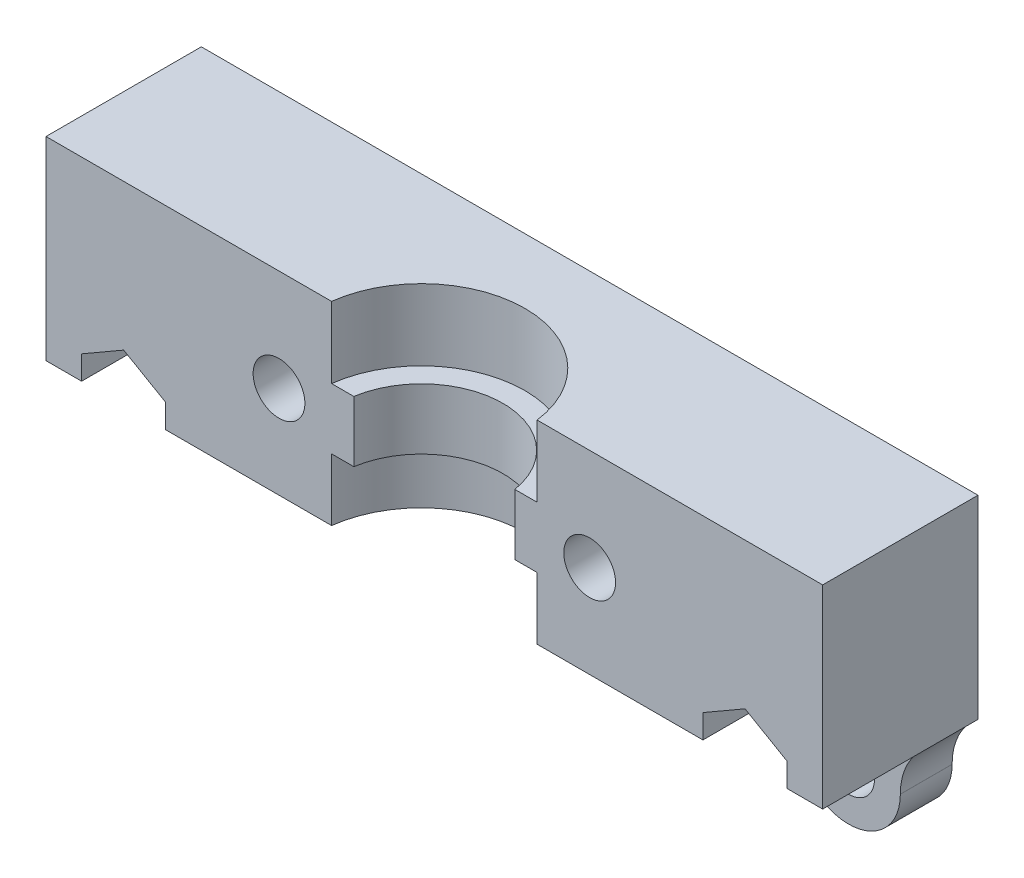
from build123d import *

# Parameters (mm, degrees)
SCHIZZO1_W                   = 60
SCHIZZO1_H                   = 30
ESTRUSIONE_ESTRUSIONE1_DEPTH = 5
SCHIZZO2_W                   = 60
SCHIZZO2_H                   = 8
ESTRUSIONE_ESTRUSIONE2_DEPTH = 20
SCHIZZO3_R                   = 5
TAGLIO_ESTRUSIONE1_DEPTH     = 8
RACCORDO1_R                  = 20
SCHIZZO4_W                   = 60
SCHIZZO4_H                   = 15
ESTRUSIONE_ESTRUSIONE3_DEPTH = 10
SCHIZZO6_R                   = 8
TAGLIO_ESTRUSIONE2_DEPTH     = 15
SCHIZZO8_W                   = 60
SCHIZZO8_H                   = 4.7
ESTRUSIONE_ESTRUSIONE4_DEPTH = 10
SCHIZZO9_R                   = 6.3
TAGLIO_ESTRUSIONE3_DEPTH     = 5
SCHIZZO10_R                  = 2
TAGLIO_ESTRUSIONE4_DEPTH     = 37.742346142
SCHIZZO11_W                  = 60
SCHIZZO11_H                  = 8
TAGLIO_ESTRUSIONE5_DEPTH     = 25
SCHIZZO14_W                  = 60
SCHIZZO14_H                  = 5
TAGLIO_ESTRUSIONE7_DEPTH     = 7
SCHIZZO12_R                  = 2
ESTRUSIONE_ESTRUSIONE5_DEPTH = 4
SCHIZZO17_W                  = 60
SCHIZZO17_H                  = 15
TAGLIO_ESTRUSIONE9_DEPTH     = 3
TAGLIO_ESTRUSIONE10_REACH    = 38.058
TAGLIO_ESTRUSIONE12_DEPTH    = 8
RACCORDO2_R                  = 5
RACCORDO3_R                  = 10


with BuildPart() as part:
    # Schizzo1 → Estrusione-Estrusione1 (new body)
    with BuildSketch(Plane.XY):
        Rectangle(SCHIZZO1_W, SCHIZZO1_H)
    extrude(amount=ESTRUSIONE_ESTRUSIONE1_DEPTH)

    # Schizzo2 → Estrusione-Estrusione2 (add)
    with BuildSketch(Plane.XY.offset(5)):
        with Locations((0, 11)):
            Rectangle(SCHIZZO2_W, SCHIZZO2_H)
    extrude(amount=ESTRUSIONE_ESTRUSIONE2_DEPTH)

    # Schizzo3 → Taglio-Estrusione1 (cut)
    with BuildSketch(Plane(origin=(0, 15, 0), x_dir=(1, 0, 0), z_dir=(0, 1, 0))):
        with Locations(Location((11, -13, 0), (0, 0, 270))):
            Circle(SCHIZZO3_R)
        with Locations(Location((-11, -13, 0), (0, 0, 270))):
            Circle(SCHIZZO3_R)
    extrude(amount=-TAGLIO_ESTRUSIONE1_DEPTH, mode=Mode.SUBTRACT)

    # Raccordo1
    raccordo1_edges = [part.edges().sort_by_distance(p)[0] for p in [
        (30, 11, 25),
        (-30, 11, 25),
    ]]
    fillet(raccordo1_edges, radius=RACCORDO1_R)

    # Schizzo4 → Estrusione-Estrusione3 (add)
    with BuildSketch(Plane.XY.offset(5)):
        with Locations((0, -0.5)):
            Rectangle(SCHIZZO4_W, SCHIZZO4_H)
    extrude(amount=ESTRUSIONE_ESTRUSIONE3_DEPTH)

    # Schizzo6 → Taglio-Estrusione2 (cut)
    with BuildSketch(Plane.XZ.offset(8)):
        with Locations((0, 13)):
            Circle(SCHIZZO6_R)
    extrude(amount=-TAGLIO_ESTRUSIONE2_DEPTH, mode=Mode.SUBTRACT)

    # Schizzo8 → Estrusione-Estrusione4 (add)
    with BuildSketch(Plane.XY.offset(15)):
        with Locations((0, -0.85)):
            Rectangle(SCHIZZO8_W, SCHIZZO8_H)
    extrude(amount=-ESTRUSIONE_ESTRUSIONE4_DEPTH)

    # Schizzo9 → Taglio-Estrusione3 (cut)
    with BuildSketch(Plane.XZ.offset(3.2)):
        with Locations((0, 13)):
            Circle(SCHIZZO9_R)
    extrude(amount=-TAGLIO_ESTRUSIONE3_DEPTH, mode=Mode.SUBTRACT)

    # Schizzo10 → Taglio-Estrusione4 (cut, through all)
    with BuildSketch(Plane.XY.offset(15)):
        with Locations((12, -0.85)):
            Circle(SCHIZZO10_R)
        with Locations((-12, -0.85)):
            Circle(SCHIZZO10_R)
    extrude(amount=-TAGLIO_ESTRUSIONE4_DEPTH, mode=Mode.SUBTRACT)

    # Schizzo11 → Taglio-Estrusione5 (cut)
    with BuildSketch(Plane(origin=(0, 0, 0), x_dir=(-1, 0, 0), z_dir=(0, 0, -1))):
        with Locations((0, 11)):
            Rectangle(SCHIZZO11_W, SCHIZZO11_H)
    extrude(amount=-TAGLIO_ESTRUSIONE5_DEPTH, mode=Mode.SUBTRACT)

    # Schizzo14 → Taglio-Estrusione7 (cut)
    with BuildSketch(Plane.XZ.offset(15)):
        with Locations((0, 2.5)):
            Rectangle(SCHIZZO14_W, SCHIZZO14_H)
    extrude(amount=-TAGLIO_ESTRUSIONE7_DEPTH, mode=Mode.SUBTRACT)

    # Schizzo12 → Estrusione-Estrusione5 (add)
    with BuildSketch(Plane.XY):
        with BuildLine():
            Line((-8, -8.006435696), (8, -8.006435696))
            Line((8, -8.006435696), (20, -8.006435696))
            Line((20, -8.006435696), (20, -12.006435696))
            ThreePointArc((20, -12.006435696), (24, -16.006435696), (28, -12.006435696))
            Line((28, -12.006435696), (28, -5.256435696))
            Line((28, -5.256435696), (-28, -5.256435696))
            Line((-28, -5.256435696), (-28, -12.006435696))
            ThreePointArc((-28, -12.006435696), (-24, -16.006435696), (-20, -12.006435696))
            Line((-20, -12.006435696), (-20, -8.006435696))
            Line((-20, -8.006435696), (-8, -8.006435696))
        make_face()
        with Locations((24, -12.006435696)):
            Circle(SCHIZZO12_R, mode=Mode.SUBTRACT)
        with Locations(Location((-24, -12.006435696, 0), (0, 0, 180))):
            Circle(SCHIZZO12_R, mode=Mode.SUBTRACT)
    extrude(amount=ESTRUSIONE_ESTRUSIONE5_DEPTH)

    # Schizzo17 → Taglio-Estrusione9 (cut)
    with BuildSketch(Plane.XY.offset(15)):
        with Locations((0, -0.5)):
            Rectangle(SCHIZZO17_W, SCHIZZO17_H)
    extrude(amount=-TAGLIO_ESTRUSIONE9_DEPTH, mode=Mode.SUBTRACT)

    # Taglio-Estrusione10: up to this face of the body (flat: up to its plane)
    taglio_estrusione10_end = Plane(part.part.faces().sort_by_distance((-18.942934314, -0.495179718, 12))[0])
    # Schizzo18 → Taglio-Estrusione10 (cut, up to the picked face)
    with BuildSketch(Plane(origin=(0, 0, 0), x_dir=(-1, 0, 0), z_dir=(0, 0, -1)), mode=Mode.PRIVATE) as taglio_estrusione10_sk1:
        with BuildLine():
            Line((-26, -8.043105695), (-26, -12.006435696))
            Line((-26, -12.006435696), (-22, -12.006435696))
            Line((-22, -12.006435696), (-22, -8.043105695))
            ThreePointArc((-22, -8.043105695), (-24, -6.043105695), (-26, -8.043105695))
        make_face()
    taglio_estrusione10_tool1 = split(extrude(taglio_estrusione10_sk1.sketch, amount=-TAGLIO_ESTRUSIONE10_REACH, mode=Mode.PRIVATE), bisect_by=taglio_estrusione10_end, keep=Keep.BOTH, mode=Mode.PRIVATE)
    # Schizzo18 → Taglio-Estrusione10 (cut, up to the picked face)
    with BuildSketch(Plane(origin=(0, 0, 0), x_dir=(-1, 0, 0), z_dir=(0, 0, -1)), mode=Mode.PRIVATE) as taglio_estrusione10_sk2:
        with BuildLine():
            Line((22, -12.006435696), (22, -8.043105695))
            ThreePointArc((22, -8.043105695), (24, -6.043105695), (26, -8.043105695))
            Line((26, -8.043105695), (26, -12.006435696))
            Line((26, -12.006435696), (22, -12.006435696))
        make_face()
    taglio_estrusione10_tool2 = split(extrude(taglio_estrusione10_sk2.sketch, amount=-TAGLIO_ESTRUSIONE10_REACH, mode=Mode.PRIVATE), bisect_by=taglio_estrusione10_end, keep=Keep.BOTH, mode=Mode.PRIVATE)
    add(taglio_estrusione10_tool1.solids().sort_by(Axis((24, -9.221369, 0), (0, 0, 1)))[0], mode=Mode.SUBTRACT)
    add(taglio_estrusione10_tool2.solids().sort_by(Axis((-24, -9.221369, 0), (0, 0, 1)))[0], mode=Mode.SUBTRACT)

    # Schizzo20 → Taglio-Estrusione12 (cut)
    with BuildSketch(Plane.XY.offset(4)):
        Polygon((-27.25, -9.91949407), (-24, -11.795882445), (-20.75, -9.91949407), (-20.75, -6.166717321), (-24, -4.290328946), (-27.25, -6.166717321), align=None)
    taglio_estrusione12 = extrude(amount=TAGLIO_ESTRUSIONE12_DEPTH, mode=Mode.SUBTRACT)

    # Specchia1: Taglio-Estrusione12 across plane
    add(taglio_estrusione12.mirror(Plane(origin=(0, 0, 0), x_dir=(0, 0, 1), z_dir=(1, 0, 0))), mode=Mode.SUBTRACT)

    # Raccordo2
    # the kernel refuses this fillet: 5 mm, written as the material it adds along each edge
    with BuildSketch(Plane(origin=(28, -8, 4), x_dir=(1, 0, 0), z_dir=(0, 0, -1))) as raccordo2_piece_1:
        with BuildLine():
            CenterArc((5, 4), RACCORDO2_R, 180, 53.130102354)
            Line((0, 4), (0, 0))
            Line((0, 0), (2, 0))
        make_face()
    extrude(amount=4)
    with BuildSketch(Plane(origin=(-28, -8, 0), x_dir=(2.553025400590997e-07, -0.9999999999999674, 0), z_dir=(0, 0, 1))) as raccordo2_piece_2:
        with BuildLine():
            CenterArc((4.000000448, -4.999998721), RACCORDO2_R, 89.959025437, 53.171095231)
            Line((-5.11e-07, -2), (-0.400000606, -1.700000128))
            ThreePointArc((-0.400000606, -1.700000128), (-0.500000255, -0.999999872), (-0.5, 1.28e-07))
            Line((-0.5, 1.28e-07), (1.28e-07, 0.5))
            Line((1.28e-07, 0.5), (4.003933724, 0.499999872))
            Line((4.003933724, 0.499999872), (4.003576153, 0))
        make_face()
    extrude(amount=4)

    # Raccordo3
    raccordo3_edges = [part.edges().sort_by_distance(p)[0] for p in [
        (-20, -8.006435696, 2),
        (20, -8.006435696, 2),
    ]]
    fillet(raccordo3_edges, radius=RACCORDO3_R)


solid = part.part
